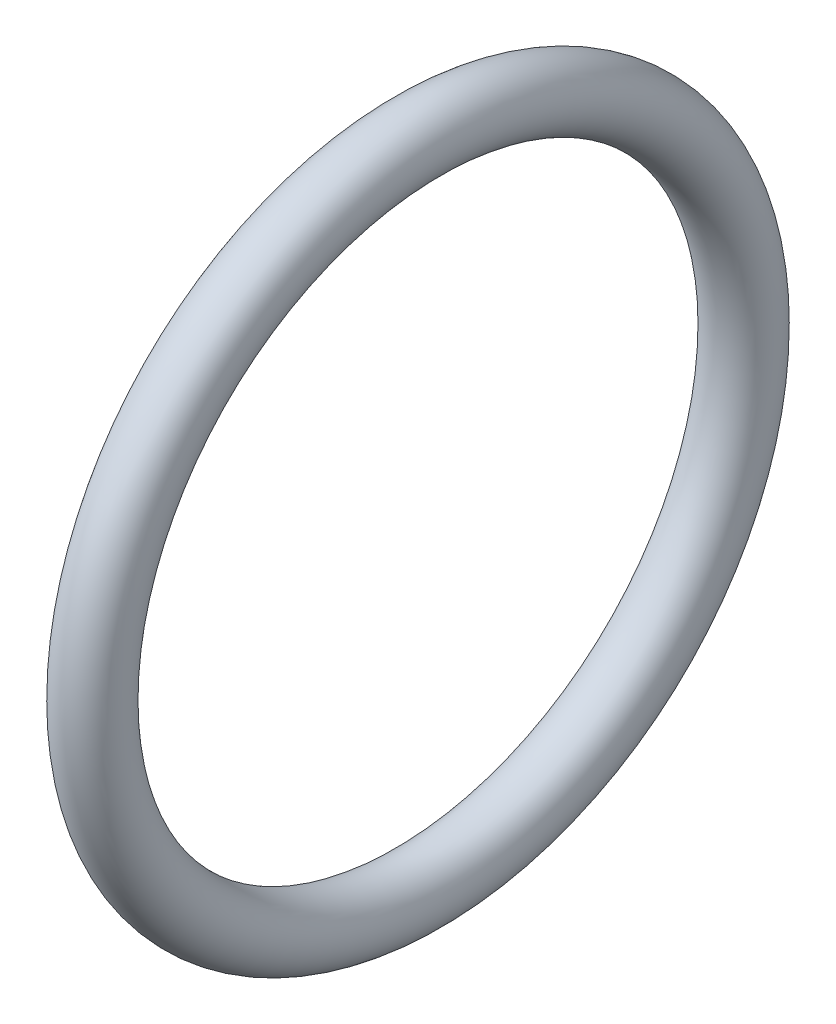
from build123d import *

# Parameters (mm, degrees)
ESBO_O1_R = 1.2


with BuildPart() as part:
    # Esboço1 → Revolução1 (revolve)
    with BuildSketch(Plane.XY):
        with Locations((0, 12.1)):
            Circle(ESBO_O1_R)
    revolve(axis=Axis((0, 0, 0), (1, 0, 0)))


solid = part.part
